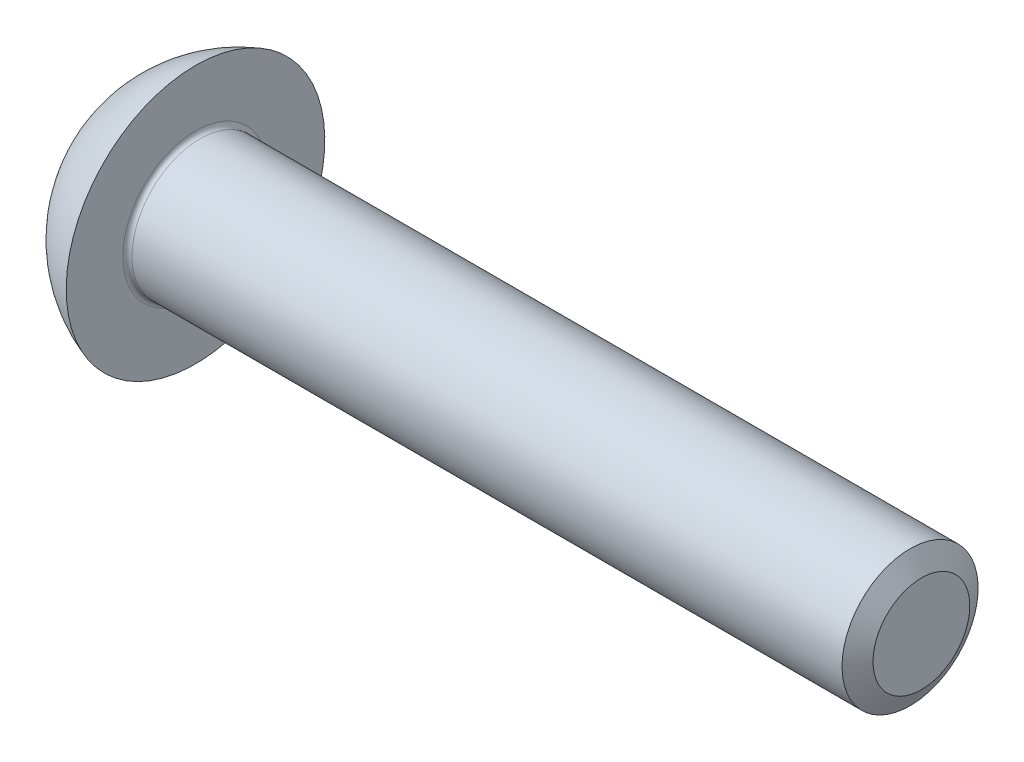
from build123d import *

# Parameters (mm, degrees)
CUT_EXTRUDE_1_DEPTH = 1.65


with BuildPart() as part:
    # 草图1 → 旋转1 (revolve)
    with BuildSketch(Plane.XY):
        with BuildLine():
            Line((0, 1.5), (-15.9, 1.5))
            ThreePointArc((-15.9, 1.5), (-15.970710678, 1.529289322), (-16, 1.6))
            Line((-16, 1.6), (-16, 2.85))
            ThreePointArc((-16, 2.85), (-16.948716751, 2.326209363), (-17.65, 1.5))
            Line((-17.65, 1.5), (-17.65, 0))
            Line((-17.65, 0), (0, 0))
            Line((0, 0), (0, 1.5))
        make_face()
    revolve(axis=Axis((-17.65, 0, 0), (1, 0, 0)))

    # 草图2 → 切除-拉伸1 (cut)
    with BuildSketch(Plane.ZY.offset(17.65)):
        Polygon((0, 1.154700538), (-1, 0.577350269), (-1, -0.577350269), (0, -1.154700538), (1, -0.577350269), (1, 0.577350269), align=None)
    extrude(amount=-CUT_EXTRUDE_1_DEPTH, mode=Mode.SUBTRACT)

    # 草图6 → 旋转2 (revolve)
    with BuildSketch(Plane.XY):
        Polygon((-16.61, 1.154700538), (-16, 0), (-15.7, 0), (-15.7, 1.154700538), align=None)
    revolve(axis=Axis((-17.65, 0, 0), (1, 0, 0)))

    # 草图7 → 切除-旋转5 (revolve, cut)
    with BuildSketch(Plane.XY):
        Polygon((-17.65, 1.154700538), (-17.35, 0), (-17.65, 0), align=None)
    revolve(axis=Axis((-17.65, 0, 0), (1, 0, 0)), mode=Mode.SUBTRACT)

    # 草图4 → 切除-旋转1 (revolve, cut)
    with BuildSketch(Plane.XY):
        Polygon((-0.25, 1.5), (0, 1.066987298), (0.25, 1.5), align=None)
    revolve(axis=Axis((-0.25, 0, 0), (1, 0, 0)), mode=Mode.SUBTRACT)


solid = part.part
